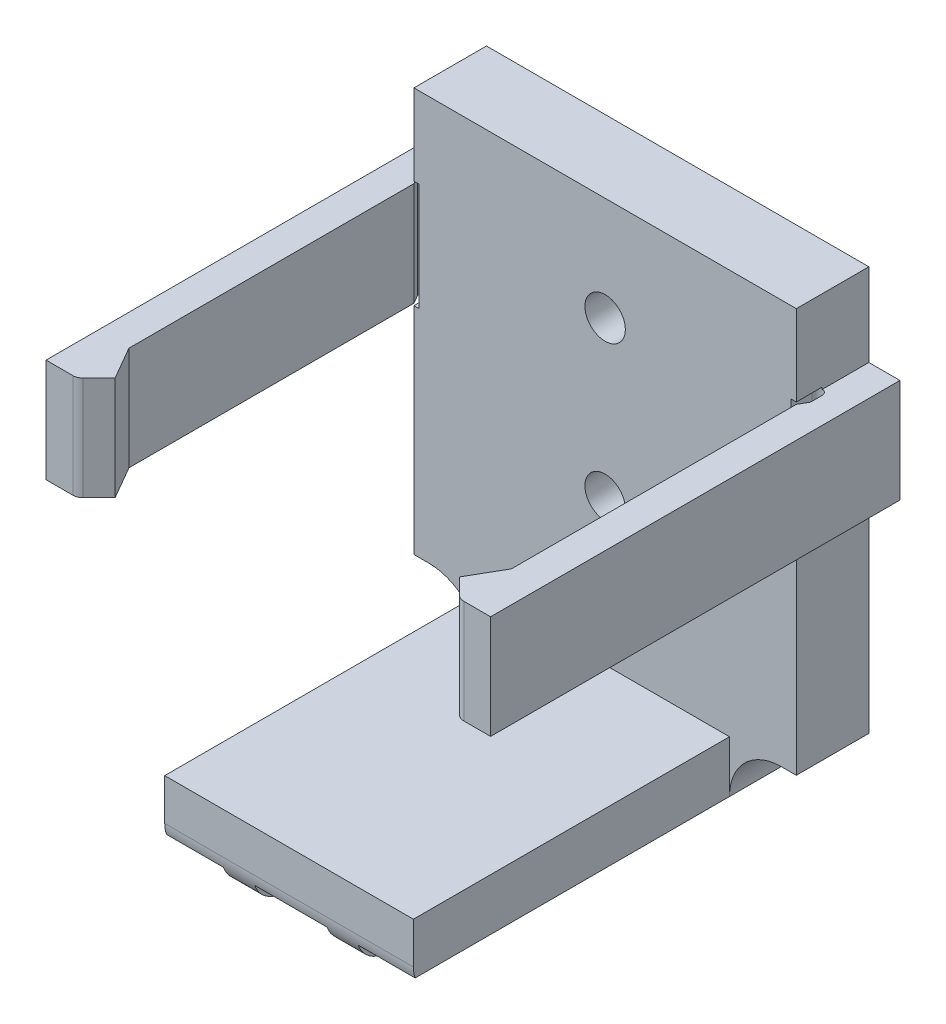
from build123d import *

# Parameters (mm, degrees)
SKETCH_1_W          = 36.9
SKETCH_1_H          = 39
EXTRUDE_1_DEPTH     = 7
SKETCH_2_W          = 24
SKETCH_2_H          = 37.5
EXTRUDE_2_DEPTH     = 5
SKETCH_4_W          = 39.5
SKETCH_4_H          = 10
EXTRUDE_3_DEPTH     = 3
EXTRUDE_4_DEPTH     = 10
CUT_EXTRUDE_3_DEPTH = 10
CUT_EXTRUDE_START   = 0.2
CUT_EXTRUDE_4_DEPTH = 0.2
CUT_EXTRUDE_START_2 = -10
CUT_EXTRUDE_5_DEPTH = 0.2
FILLET_1_R          = 5
FILLET_2_R          = 1
MIRROR_START        = 20.8
MIRROR_4_DEPTH      = 10.4
MIRROR_START_2      = 21
MIRROR_4_2_DEPTH    = 10
FILLET_3_R          = 1
SKETCH_7_W          = 3
SKETCH_7_H          = 37.5
EXTRUDE_5_DEPTH     = 2
FILLET_4_R          = 3
SKETCH_8_R          = 1.95
CUT_EXTRUDE_6_DEPTH = 65.569807186


# Read off the part's stored shape, not the designer's step: 鏡射4
with BuildPart() as part:
    # 草圖1 → 填料-伸長1 (new body)
    with BuildSketch(Plane.XY):
        with Locations((18.45, 19.5)):
            Rectangle(SKETCH_1_W, SKETCH_1_H)
    extrude(amount=EXTRUDE_1_DEPTH)

    # 草圖2 → 填料-伸長2 (add)
    with BuildSketch(Plane.XZ):
        with Locations((18.45, 18.75)):
            Rectangle(SKETCH_2_W, SKETCH_2_H)
    extrude(amount=EXTRUDE_2_DEPTH)

    # 草圖4 → 填料-伸長3 (add)
    with BuildSketch(Plane(origin=(36.9, 0, 0), x_dir=(0, 0, -1), z_dir=(1, 0, 0))):
        with Locations((-19.75, 26)):
            Rectangle(SKETCH_4_W, SKETCH_4_H)
    extrude(amount=EXTRUDE_3_DEPTH)

    # 草圖5 → 填料-伸長4 (add)
    with BuildSketch(Plane(origin=(0, 31, 0), x_dir=(1, 0, 0), z_dir=(0, 1, 0))):
        Polygon((36.9, -39.5), (35.069872981, -37.669872981), (36.9, -34.5), align=None)
    extrude(amount=-EXTRUDE_4_DEPTH)

    # 草圖6 → 除料-伸長3 (cut)
    with BuildSketch(Plane(origin=(0, 31, 0), x_dir=(1, 0, 0), z_dir=(0, 1, 0))):
        with BuildLine():
            Line((36.398110453, -7), (36.899055226, -7))
            Line((36.899055226, -7), (37.4, -6.1323382))
            Line((37.4, -6.1323382), (37.4, -5))
            ThreePointArc((37.4, -5), (36.899055226, -4.499055226), (36.398110453, -5))
            Line((36.398110453, -5), (36.398110453, -7))
        make_face()
    extrude(amount=-CUT_EXTRUDE_3_DEPTH, mode=Mode.SUBTRACT)

    # 草圖6<2> → 除料-伸長4 (cut)
    with BuildSketch(Plane(origin=(0, 31, 0), x_dir=(1, 0, 0), z_dir=(0, 1, 0)).offset(CUT_EXTRUDE_START)):
        with BuildLine():
            Line((36.398110453, -7), (36.899055226, -7))
            Line((36.899055226, -7), (37.4, -6.1323382))
            Line((37.4, -6.1323382), (37.4, -5))
            ThreePointArc((37.4, -5), (36.899055226, -4.499055226), (36.398110453, -5))
            Line((36.398110453, -5), (36.398110453, -7))
        make_face()
    extrude(amount=-CUT_EXTRUDE_4_DEPTH, mode=Mode.SUBTRACT)

    # 草圖6<3> → 除料-伸長5 (cut)
    with BuildSketch(Plane(origin=(0, 31, 0), x_dir=(1, 0, 0), z_dir=(0, 1, 0)).offset(CUT_EXTRUDE_START_2)):
        with BuildLine():
            Line((36.398110453, -7), (36.899055226, -7))
            Line((36.899055226, -7), (37.4, -6.1323382))
            Line((37.4, -6.1323382), (37.4, -5))
            ThreePointArc((37.4, -5), (36.899055226, -4.499055226), (36.398110453, -5))
            Line((36.398110453, -5), (36.398110453, -7))
        make_face()
    extrude(amount=-CUT_EXTRUDE_5_DEPTH, mode=Mode.SUBTRACT)

    # 圓角1
    fillet_1_edges = [part.edges().sort_by_distance(p)[0] for p in [
        (6.45, 0, 3.5),
        (30.45, 0, 3.5),
    ]]
    fillet(fillet_1_edges, radius=FILLET_1_R - 0.0001)  # a hair under: the kernel refuses the full size

    # 圓角2
    fillet_2_edges = [part.edges().sort_by_distance(p)[0] for p in [
        (36.9, 26, 39.5),
    ]]
    fillet(fillet_2_edges, radius=FILLET_2_R)

    # 鏡射4 outline → 鏡射4 (cut)
    with BuildSketch(Plane(origin=(0, 0, 0), x_dir=(1, 0, 0), z_dir=(0, 1, 0)).offset(MIRROR_START)):
        with BuildLine():
            Line((0, -4.499056117), (0, -6.998363603))
            Line((0, -6.998363603), (0.000944774, -7))
            Line((0.000944774, -7), (0.501889547, -7))
            Line((0.501889547, -7), (0.501889547, -5))
            ThreePointArc((0.501889547, -5), (0.354832035, -4.645444683), (0, -4.499056117))
        make_face()
    extrude(amount=MIRROR_4_DEPTH, mode=Mode.SUBTRACT)

    # Mirror 4 2 outline → Mirror 4 2 (add)
    with BuildSketch(Plane(origin=(0, 0, 0), x_dir=(1, 0, 0), z_dir=(0, 1, 0)).offset(MIRROR_START_2)):
        with BuildLine():
            Line((0, -34.5), (0, -6.998363603))
            Line((0, -6.998363603), (-0.5, -6.1323382))
            Line((-0.5, -6.1323382), (-0.5, -5))
            ThreePointArc((-0.5, -5), (-0.353610544, -4.646112739), (0, -4.499056117))
            Line((0, -4.499056117), (0, 0))
            Line((0, 0), (-3, 0))
            Line((-3, 0), (-3, -39.5))
            Line((-3, -39.5), (0, -39.5))
            Line((0, -39.5), (1.830127019, -37.669872981))
            Line((1.830127019, -37.669872981), (0, -34.5))
        make_face()
    extrude(amount=MIRROR_4_2_DEPTH)

    # 圓角3
    fillet_3_edges = [part.edges().sort_by_distance(p)[0] for p in [
        (0, 26, 39.5),
    ]]
    fillet(fillet_3_edges, radius=FILLET_3_R)

    # 草圖7 → 填料-伸長5 (add)
    with BuildSketch(Plane.XZ.offset(5)):
        with Locations((13.45, 18.75)):
            Rectangle(SKETCH_7_W, SKETCH_7_H)
        with Locations((23.45, 18.75)):
            Rectangle(SKETCH_7_W, SKETCH_7_H)
    extrude(amount=EXTRUDE_5_DEPTH)

    # 圓角4
    fillet_4_edges = [part.edges().sort_by_distance(p)[0] for p in [
        (13.45, -7, 37.5),
    ]]
    fillet(fillet_4_edges, radius=FILLET_4_R)

    # 草圖8 → 除料-伸長6 (cut, through all)
    with BuildSketch(Plane.XY.offset(7)):
        with Locations((18.45, 29)):
            Circle(SKETCH_8_R)
        with Locations((18.45, 14)):
            Circle(SKETCH_8_R)
    extrude(amount=-CUT_EXTRUDE_6_DEPTH, mode=Mode.SUBTRACT)


solid = part.part
